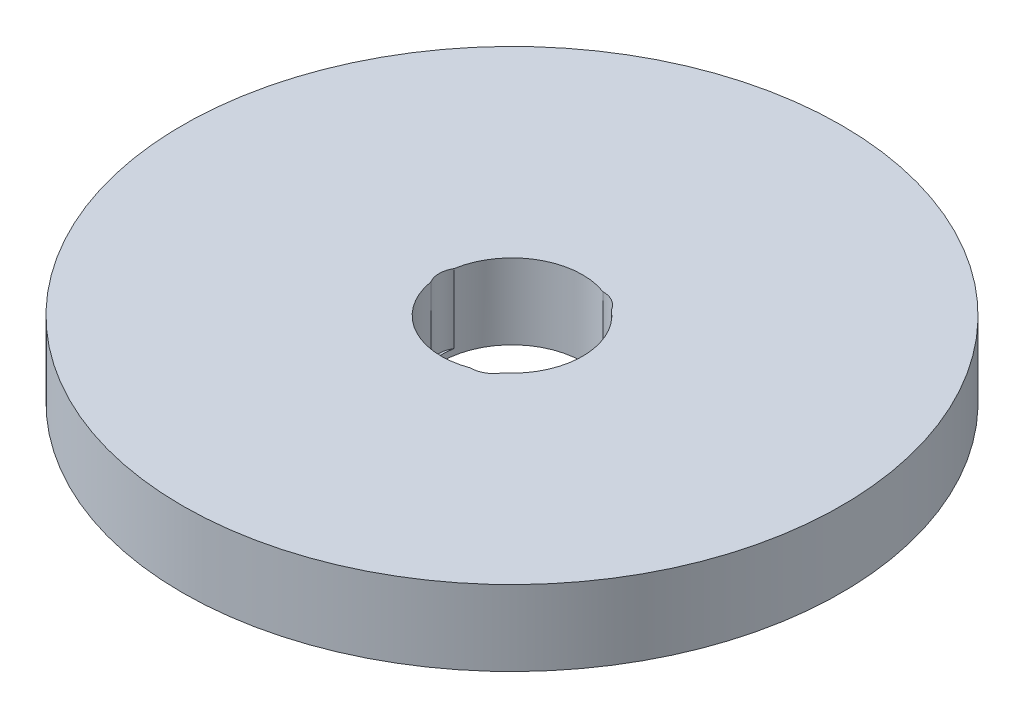
from build123d import *

# Parameters (mm, degrees)
SKETCH1_R           = 70
BOSS_EXTRUDE1_DEPTH = 16
SKETCH2_R           = 15
CUT_EXTRUDE1_DEPTH  = 101.279609094
SKETCH3_R           = 4.790513389
CUT_EXTRUDE2_DEPTH  = 14.709337558
CIRPATTERN1_COUNT   = 3


with BuildPart() as part:
    # Sketch1 → Boss-Extrude1 (new body)
    with BuildSketch(Plane(origin=(0, 0, 0), x_dir=(1, 0, 0), z_dir=(0, 1, 0))):
        Circle(SKETCH1_R)
    extrude(amount=BOSS_EXTRUDE1_DEPTH)

    # Sketch2 → Cut-Extrude1 (cut, through all)
    with BuildSketch(Plane(origin=(0, 0, 0), x_dir=(1, 0, 0), z_dir=(0, 1, 0))):
        Circle(SKETCH2_R)
    extrude(amount=CUT_EXTRUDE1_DEPTH, mode=Mode.SUBTRACT)

    # Sketch3 → Cut-Extrude2 (cut)
    with BuildSketch(Plane(origin=(0, 16, 0), x_dir=(1, 0, 0), z_dir=(0, 1, 0))):
        with Locations((-10.678298588, 0)):
            Circle(SKETCH3_R)
    cut_extrude2 = extrude(amount=-CUT_EXTRUDE2_DEPTH, mode=Mode.SUBTRACT)

    # CirPattern1: Cut-Extrude2 ×3 about axis
    cirpattern1_axis = Axis((0, 0, 0), (0, 1, 0))
    for i in range(1, CIRPATTERN1_COUNT):
        add(cut_extrude2.rotate(cirpattern1_axis, i * 360 / CIRPATTERN1_COUNT), mode=Mode.SUBTRACT)


solid = part.part
